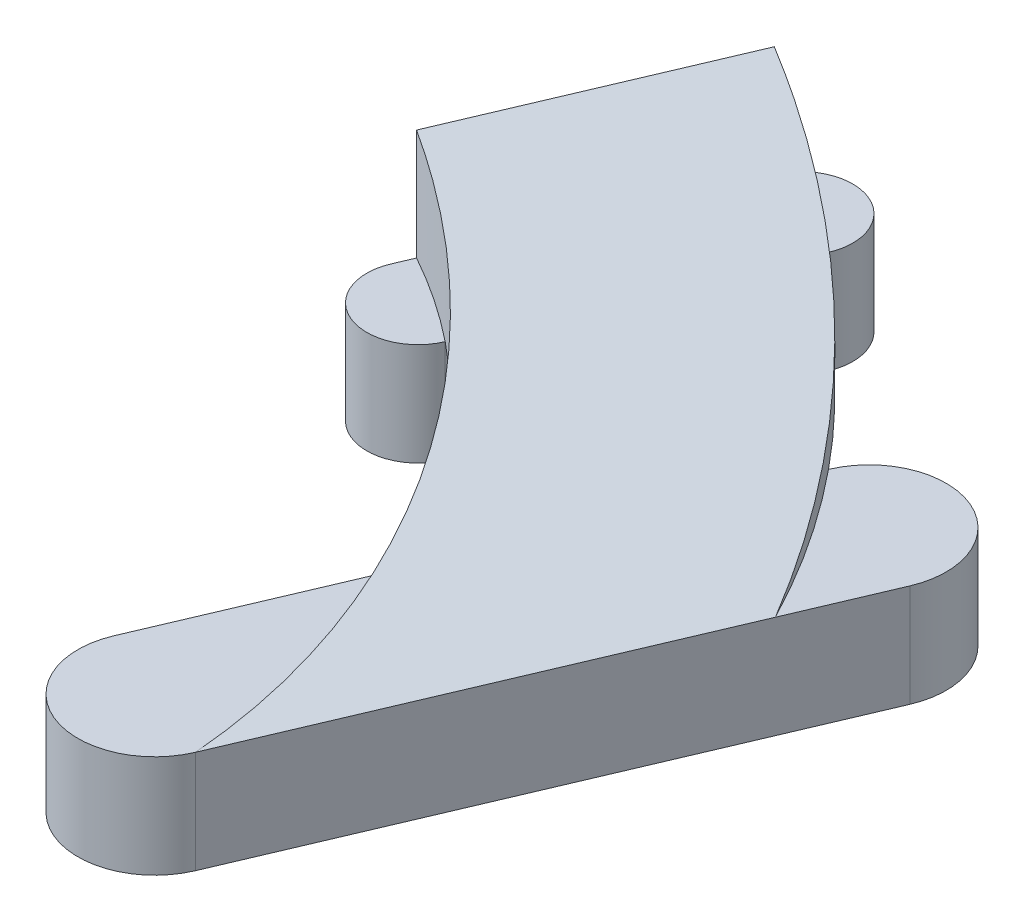
from build123d import *

# Parameters (mm, degrees)
BOSS_EXTRUDE4_DEPTH    = 13.716
CUT_EXTRUDE2_START     = 13.394831099
CUT_EXTRUDE2_OUTLINE_W = 71
CUT_EXTRUDE2_OUTLINE_H = 102
CUT_EXTRUDE2_DEPTH     = 19.052275388
BOSS_EXTRUDE7_DEPTH    = 12.7


# Read off the part's stored shape, not the designer's step: Cut-Extrude2
with BuildPart() as part:
    # Sketch2 → Boss-Extrude4 (new body)
    with BuildSketch(Plane(origin=(0, 0, 0), x_dir=(1, 0, 0), z_dir=(0, 1, 0))):
        with BuildLine():
            Line((0, 0), (13.212422732, 31.078396728))
            ThreePointArc((13.212422732, 31.078396728), (47.046788058, 4.181077282), (67.884833627, -33.687193436))
            Line((67.884833627, -33.687193436), (67.884833627, -66.675))
            Line((67.884833627, -66.675), (39.309833627, -66.675))
            ThreePointArc((39.309833627, -66.675), (28.750791411, -27.974810579), (0, 0))
        make_face()
    extrude(amount=BOSS_EXTRUDE4_DEPTH)

    # Cut-Extrude2 outline → Cut-Extrude2 (cut)
    with BuildSketch(Plane(origin=(0, 0, 0), x_dir=(0.9802048878944475, -0.19725451306837943, -0.017001024145327306), z_dir=(0.19798580188446208, 0.9765843612447384, 0.08417011122942132)).offset(CUT_EXTRUDE2_START)):
        with Locations((31.5, -17)):
            Rectangle(CUT_EXTRUDE2_OUTLINE_W, CUT_EXTRUDE2_OUTLINE_H)
    extrude(amount=CUT_EXTRUDE2_DEPTH, mode=Mode.SUBTRACT)

    # Sketch16 → Boss-Extrude7 (add)
    with BuildSketch(Plane.XZ):
        with BuildLine():
            Line((32.238416067, 34.617565762), (48.16212184, -2.83833884))
            ThreePointArc((48.16212184, -2.83833884), (60.654452135, -7.877479025), (65.69359232, 4.614851269))
            Line((65.69359232, 4.614851269), (60.724626835, 16.302903023))
            Line((60.724626835, 16.302903023), (39.309833627, 66.675))
            ThreePointArc((39.309833627, 66.675), (26.817503332, 71.714140186), (21.778363147, 59.221809891))
            Line((21.778363147, 59.221809891), (32.238416067, 34.617565762))
        make_face()
        with BuildLine():
            Line((10.740738204, 7.196121991), (24.250560746, -24.581821632))
            Line((24.250560746, -24.581821632), (24.900069719, -26.109603322))
            ThreePointArc((24.900069719, -26.109603322), (21.540642929, -34.437823519), (13.212422732, -31.078396728))
            Line((13.212422732, -31.078396728), (0, 0))
            Line((0, 0), (-0.946908783, 2.227328585))
            ThreePointArc((-0.946908783, 2.227328585), (2.412518007, 10.555548781), (10.740738204, 7.196121991))
        make_face()
    extrude(amount=BOSS_EXTRUDE7_DEPTH)


solid = part.part
